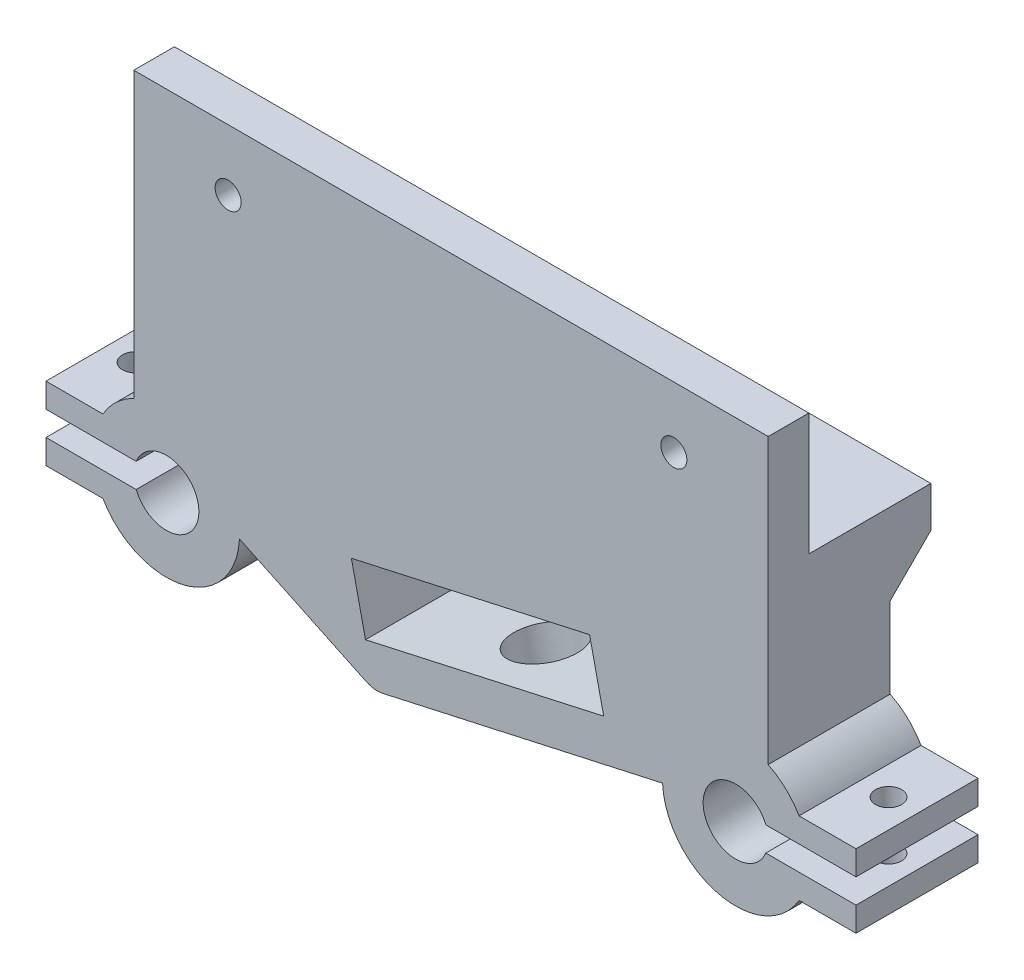
from build123d import *

# Parameters (mm, degrees)
BOSS_EXTRUDE1_DEPTH = 15
CUT_EXTRUDE1_START  = -13
CUT_EXTRUDE1_DEPTH  = 13
BOSS_EXTRUDE2_DEPTH = 13
SKETCH5_R           = 4
CUT_EXTRUDE2_DEPTH  = 18
SKETCH6_W           = 78
SKETCH6_H           = 5
BOSS_EXTRUDE3_DEPTH = 15
SKETCH7_W           = 78
SKETCH7_H           = 5
BOSS_EXTRUDE4_DEPTH = 5
CUT_EXTRUDE3_REACH  = 69.479
SKETCH8_R           = 1.6
CUT_EXTRUDE4_REACH  = 67.18
SKETCH9_R           = 1.6
CHAMFER1_SIZE       = 5
FILLET1_R           = 3
FILLET2_R           = 3
SKETCH10_R          = 1.6
CUT_EXTRUDE5_DEPTH  = 72.66390448


with BuildPart() as part:
    # Sketch2 → Boss-Extrude1 (new body)
    with BuildSketch(Plane.XY):
        with BuildLine():
            Line((-39, 28), (39, 28))
            Line((39, 28), (39, 8.062257748))
            ThreePointArc((39, 8.062257748), (41.160225429, 6.561373535), (42.794228634, 4.5))
            Line((42.794228634, 4.5), (49.794228634, 4.5))
            Line((49.794228634, 4.5), (49.794228634, 1.5))
            Line((49.794228634, 1.5), (38.708099244, 1.5))
            ThreePointArc((38.708099244, 1.5), (31, 0), (38.708099244, -1.5))
            Line((38.708099244, -1.5), (49.794228634, -1.5))
            Line((49.794228634, -1.5), (49.794228634, -4.5))
            Line((49.794228634, -4.5), (42.794228634, -4.5))
            ThreePointArc((42.794228634, -4.5), (32.868581203, -8.743972433), (26.009276503, -0.408522957))
            Line((26.009276503, -0.408522957), (-9.429697367, -8.278133847))
            Line((-9.429697367, -8.278133847), (-26.009276503, -0.408522957))
            ThreePointArc((-26.009276503, -0.408522957), (-32.868581203, -8.743972433), (-42.794228634, -4.5))
            Line((-42.794228634, -4.5), (-49.794228634, -4.5))
            Line((-49.794228634, -4.5), (-49.794228634, -1.5))
            Line((-49.794228634, -1.5), (-38.708099244, -1.5))
            ThreePointArc((-38.708099244, -1.5), (-31, 0), (-38.708099244, 1.5))
            Line((-38.708099244, 1.5), (-49.794228634, 1.5))
            Line((-49.794228634, 1.5), (-49.794228634, 4.5))
            Line((-49.794228634, 4.5), (-42.794228634, 4.5))
            ThreePointArc((-42.794228634, 4.5), (-41.160225429, 6.561373535), (-39, 8.062257748))
            Line((-39, 8.062257748), (-39, 28))
        make_face()
        Polygon((-10.513599328, -3.397031867), (-12.247842467, 4.4127313), (17.038769412, 10.916143071), (18.773012551, 3.106379903), align=None, mode=Mode.SUBTRACT)
    extrude(amount=-BOSS_EXTRUDE1_DEPTH)

    # Sketch3 → Cut-Extrude1 (cut)
    with BuildSketch(Plane(origin=(0, 0, -15), x_dir=(-1, 0, 0), z_dir=(0, 0, -1)).offset(CUT_EXTRUDE1_START)):
        with BuildLine():
            Line((-34, 8.94427191), (-34, 23))
            Line((-34, 23), (34, 23))
            Line((34, 23), (34, 8.94427191))
            ThreePointArc((34, 8.94427191), (30.031333309, 7.504155603), (27.156034009, 4.4127313))
            Line((27.156034009, 4.4127313), (12.247842467, 4.4127313))
            Line((12.247842467, 4.4127313), (10.513599328, -3.397031867))
            Line((10.513599328, -3.397031867), (-27.55471368, 5.056452473))
            ThreePointArc((-27.55471368, 5.056452473), (-30.351398032, 7.706523194), (-34, 8.94427191))
        make_face()
    extrude(amount=CUT_EXTRUDE1_DEPTH, mode=Mode.SUBTRACT)

    # Sketch4 → Boss-Extrude2 (add)
    with BuildSketch(Plane(origin=(0, 0, -2), x_dir=(-1, 0, 0), z_dir=(0, 0, -1))):
        Polygon((-8.252785849, 8.96511954), (-6.51854271, 16.774882707), (5.196102042, 14.173517999), (3.461858903, 6.363754831), align=None)
    extrude(amount=BOSS_EXTRUDE2_DEPTH)

    # Sketch5 → Cut-Extrude2 (cut)
    with BuildSketch(Plane(origin=(1.308726989, -5.893549531, 0), x_dir=(0.9762203959642156, 0.21678039234089003, 0), z_dir=(0.21678039234089003, -0.9762203959642156, 0))):
        with Locations((4, -7.5)):
            Circle(SKETCH5_R)
    extrude(amount=-CUT_EXTRUDE2_DEPTH, mode=Mode.SUBTRACT)

    # Sketch6 → Boss-Extrude3 (add)
    with BuildSketch(Plane(origin=(0, 28, 0), x_dir=(1, 0, 0), z_dir=(0, 1, 0))):
        with Locations((0, 2.5)):
            Rectangle(SKETCH6_W, SKETCH6_H)
    extrude(amount=BOSS_EXTRUDE3_DEPTH)

    # Sketch7 → Boss-Extrude4 (add)
    with BuildSketch(Plane(origin=(0, 0, -15), x_dir=(-1, 0, 0), z_dir=(0, 0, -1))):
        with Locations((0, 25.5)):
            Rectangle(SKETCH7_W, SKETCH7_H)
    extrude(amount=BOSS_EXTRUDE4_DEPTH)

    # Sketch8 → Cut-Extrude3 (cut, up to next)
    with BuildSketch(Plane(origin=(0, 0, -5), x_dir=(-1, 0, 0), z_dir=(0, 0, -1)), mode=Mode.PRIVATE) as cut_extrude3_sk1:
        with Locations((27.4, 35.5)):
            Circle(SKETCH8_R)
    cut_extrude3_tool1 = extrude(cut_extrude3_sk1.sketch, amount=-CUT_EXTRUDE3_REACH, mode=Mode.PRIVATE) & part.part
    # Sketch8 → Cut-Extrude3 (cut, up to next)
    with BuildSketch(Plane(origin=(0, 0, -5), x_dir=(-1, 0, 0), z_dir=(0, 0, -1)), mode=Mode.PRIVATE) as cut_extrude3_sk2:
        with Locations((-27.4, 35.5)):
            Circle(SKETCH8_R)
    cut_extrude3_tool2 = extrude(cut_extrude3_sk2.sketch, amount=-CUT_EXTRUDE3_REACH, mode=Mode.PRIVATE) & part.part
    add(cut_extrude3_tool1.solids().sort_by_distance((-27.4, 35.5, -5))[0], mode=Mode.SUBTRACT)
    add(cut_extrude3_tool2.solids().sort_by_distance((27.4, 35.5, -5))[0], mode=Mode.SUBTRACT)

    # Sketch9 → Cut-Extrude4 (cut, up to next)
    with BuildSketch(Plane(origin=(0, 28, 0), x_dir=(1, 0, 0), z_dir=(0, 1, 0)), mode=Mode.PRIVATE) as cut_extrude4_sk1:
        with Locations(Location((-27.4, 12.5, 0), (0, 0, 270))):
            Circle(SKETCH9_R)
    cut_extrude4_tool1 = extrude(cut_extrude4_sk1.sketch, amount=-CUT_EXTRUDE4_REACH, mode=Mode.PRIVATE) & part.part
    # Sketch9 → Cut-Extrude4 (cut, up to next)
    with BuildSketch(Plane(origin=(0, 28, 0), x_dir=(1, 0, 0), z_dir=(0, 1, 0)), mode=Mode.PRIVATE) as cut_extrude4_sk2:
        with Locations(Location((27.4, 12.5, 0), (0, 0, 270))):
            Circle(SKETCH9_R)
    cut_extrude4_tool2 = extrude(cut_extrude4_sk2.sketch, amount=-CUT_EXTRUDE4_REACH, mode=Mode.PRIVATE) & part.part
    add(cut_extrude4_tool1.solids().sort_by_distance((-27.4, 28, -12.5))[0], mode=Mode.SUBTRACT)
    add(cut_extrude4_tool2.solids().sort_by_distance((27.4, 28, -12.5))[0], mode=Mode.SUBTRACT)

    # Chamfer1
    chamfer1_edges = [part.edges().sort_by_distance(p)[0] for p in [
        (36.5, 23, -15),
        (-36.5, 23, -15),
    ]]
    chamfer(chamfer1_edges, length=CHAMFER1_SIZE - 0.0001)  # a hair under: the kernel refuses the full size

    # Fillet1
    fillet1_edges = [part.edges().sort_by_distance(p)[0] for p in [
        (-4.328980472, 10.268636415, -15),
        (0.661220334, 15.474200353, -15),
        (7.385664279, 12.870001123, -15),
    ]]
    fillet(fillet1_edges, radius=FILLET1_R)

    # Fillet2
    fillet2_edges = [part.edges().sort_by_distance(p)[0] for p in [
        (-9.429697367, -8.278133847, -7.5),
    ]]
    fillet(fillet2_edges, radius=FILLET2_R)

    # Sketch10 → Cut-Extrude5 (cut, through all)
    with BuildSketch(Plane.XZ.offset(4.5)):
        with Locations(Location((46.294228634, -7.5, 0), (0, 0, 270))):
            Circle(SKETCH10_R)
        with Locations((-46.294228634, -7.5)):
            Circle(SKETCH10_R)
    extrude(amount=-CUT_EXTRUDE5_DEPTH, mode=Mode.SUBTRACT)


solid = part.part
